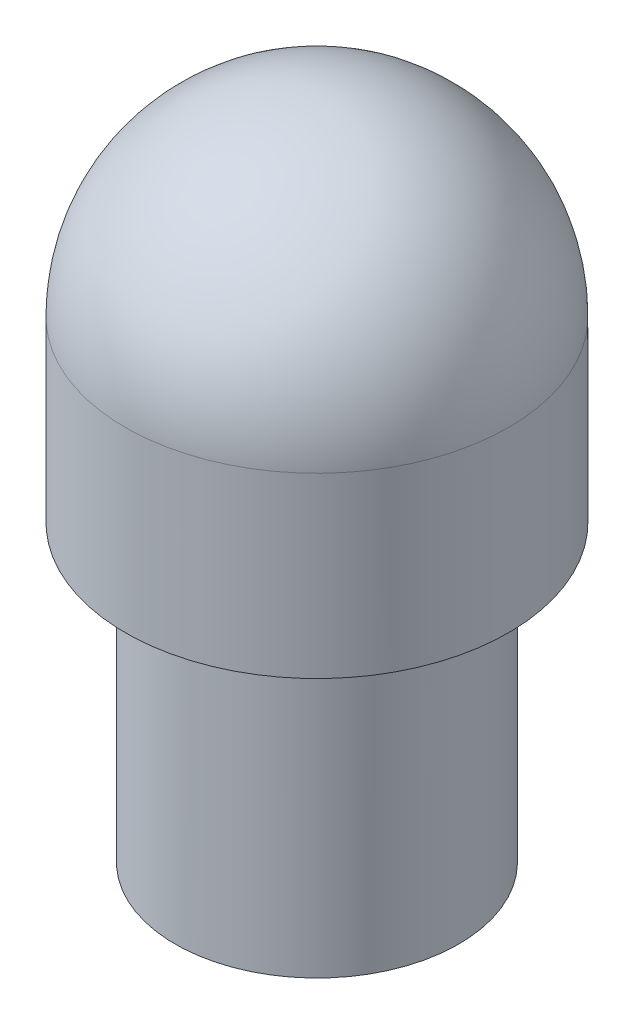
from build123d import *

# Parameters (mm, degrees)
M7X0_75_TAPPED_HOLE1_D     = 6
M7X0_75_TAPPED_HOLE1_DEPTH = 16.002
M7X0_75_TAPPED_HOLE1_TIP   = 1.802581857
SKETCH4_R                  = 3.5
CUT_EXTRUDE1_DEPTH         = 2.5
FILLET1_R                  = 0.762


with BuildPart() as part:
    # Sketch1 → Revolve1 (revolve)
    with BuildSketch(Plane.XY):
        with BuildLine():
            Line((-5.2705, 38.3921), (-5.2705, 33.5026))
            Line((-5.2705, 33.5026), (-3.899, 33.5026))
            Line((-3.899, 33.5026), (-3.899, 25.4))
            Line((-3.899, 25.4), (0, 25.4))
            Line((0, 25.4), (0, 43.6626))
            ThreePointArc((0, 43.6626), (-3.72680629, 42.11890629), (-5.2705, 38.3921))
        make_face()
    revolve(axis=Axis((0, 25.4, 0), (0, 1, 0)))

    # M7X0.75 Tapped Hole1
    with Locations(Plane(origin=(0, 25.4, 0), x_dir=(-1, 0, 0), z_dir=(0, -1, 0))):
        with Locations((0, 0)):
            Hole(M7X0_75_TAPPED_HOLE1_D / 2, depth=M7X0_75_TAPPED_HOLE1_DEPTH)
            with Locations((0, 0, -(M7X0_75_TAPPED_HOLE1_DEPTH + M7X0_75_TAPPED_HOLE1_TIP / 2))):  # 118° drill point
                Cone(0, M7X0_75_TAPPED_HOLE1_D / 2, M7X0_75_TAPPED_HOLE1_TIP, mode=Mode.SUBTRACT)

    # Sketch4 → Cut-Extrude1 (cut)
    with BuildSketch(Plane.XZ.offset(-25.4)):
        Circle(SKETCH4_R)
    extrude(amount=-CUT_EXTRUDE1_DEPTH, mode=Mode.SUBTRACT)

    # Fillet1
    fillet1_edges = [part.edges().sort_by_distance(p)[0] for p in [
        (3.899, 33.5026, 0),
    ]]
    fillet(fillet1_edges, radius=FILLET1_R)


solid = part.part
